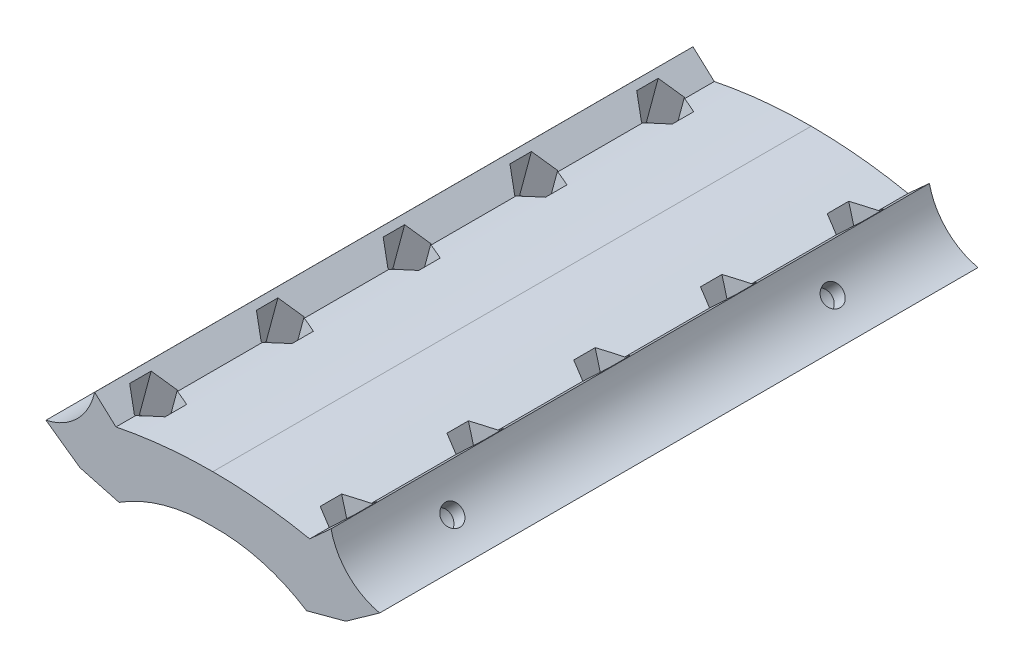
from build123d import *

# Parameters (mm, degrees)
BOSS_EXTRUDE1_DEPTH = 118
SKETCH2_R           = 2
CUT_EXTRUDE1_DEPTH  = 30
FILLET1_R           = 0.7
CUT_EXTRUDE2_DEPTH  = 30
SKETCH4_R           = 2.025006332
CUT_EXTRUDE4_DEPTH  = 30
SKETCH5_R           = 4
CUT_EXTRUDE5_DEPTH  = 30
FILLET2_R           = 0.7


# Read off the part's stored shape, not the designer's step: Boss-Extrude1
with BuildPart() as part:
    # Boss-Extrude1 outline → Boss-Extrude1 (new body)
    with BuildSketch(Plane.XY):
        with BuildLine():
            Line((128.714574933, 74.457877785), (135.398397795, 79.207299656))
            ThreePointArc((135.398397795, 79.207299656), (129.199240907, 82.59368811), (125.816397641, 88.794780298))
            Line((125.816397641, 88.794780298), (121.602102319, 84.969981006))
            ThreePointArc((121.602102319, 84.969981006), (112.099366948, 86.413667221), (102.499992147, 86.901737764))
            ThreePointArc((102.499992147, 86.901737764), (92.900246357, 86.421019341), (83.396408081, 84.984611511))
            Line((83.396408081, 84.984611511), (79.185043335, 88.812637329))
            ThreePointArc((79.185043335, 88.812637329), (75.797451765, 82.614137814), (69.595703125, 79.232498169))
            Line((69.595703125, 79.232498169), (76.275886536, 74.477958679))
            Line((76.275886536, 74.477958679), (83.999649048, 72.402679443))
            ThreePointArc((83.999649048, 72.402679443), (92.865835754, 76.342994102), (102.496399864, 77.520950486))
            ThreePointArc((102.496399864, 77.520950486), (112.126058975, 76.335618583), (120.989225269, 72.388514639))
            Line((120.989225269, 72.388514639), (128.714574933, 74.457877785))
        make_face()
    extrude(amount=BOSS_EXTRUDE1_DEPTH)

    # Sketch2 → Cut-Extrude1 (cut)
    with BuildSketch(Plane(origin=(23.799717723, 88.577654694, 0), x_dir=(0.9657473176210161, -0.2594843319119911, 0), z_dir=(-0.2594843319119911, -0.9657473176210161, 0))):
        with Locations((58.335991742, 110.012586744)):
            Circle(SKETCH2_R)
        with Locations((58.335991742, 85.012586744)):
            Circle(SKETCH2_R)
        with Locations((58.335991742, 60.012586744)):
            Circle(SKETCH2_R)
        with Locations((58.335991742, 35.012586744)):
            Circle(SKETCH2_R)
        with Locations((58.335991742, 10.012586744)):
            Circle(SKETCH2_R)
    cut_extrude1 = extrude(amount=-CUT_EXTRUDE1_DEPTH, mode=Mode.SUBTRACT)

    # Fillet1
    fillet1_edges = [part.edges().sort_by_distance(p)[0] for p in [
        (78.206050633, 73.959347515, 110.012586744),
        (78.206050633, 73.959347515, 85.012586744),
        (78.206050633, 73.959347515, 60.012586744),
        (78.206050633, 73.959347515, 35.012586744),
        (78.206050633, 73.959347515, 10.012586744),
    ]]
    fillet(fillet1_edges, radius=FILLET1_R)

    # Sketch3 → Cut-Extrude2 (cut)
    with BuildSketch(Plane(origin=(25.097139382, 93.406391282, 0), x_dir=(-0.9657473176210161, 0.2594843319119911, 0), z_dir=(-0.2594843319119911, -0.9657473176210161, 0))):
        Polygon((-58.327674116, -30.765472412), (-61.99488258, -32.882736206), (-61.99488258, -37.117263794), (-58.327674116, -39.234527588), (-54.660465652, -37.117263794), (-54.660465652, -32.882736206), align=None)
        Polygon((-58.327674116, -5.765472412), (-61.99488258, -7.882736206), (-61.99488258, -12.117263794), (-58.327674116, -14.234527588), (-54.660465652, -12.117263794), (-54.660465652, -7.882736206), align=None)
        Polygon((-58.327674116, -55.765472412), (-61.99488258, -57.882736206), (-61.99488258, -62.117263794), (-58.327674116, -64.234527588), (-54.660465652, -62.117263794), (-54.660465652, -57.882736206), align=None)
        Polygon((-58.327674116, -80.765472412), (-61.99488258, -82.882736206), (-61.99488258, -87.117263794), (-58.327674116, -89.234527588), (-54.660465652, -87.117263794), (-54.660465652, -82.882736206), align=None)
        Polygon((-58.327674116, -105.765472412), (-61.99488258, -107.882736206), (-61.99488258, -112.117263794), (-58.327674116, -114.234527588), (-54.660465652, -112.117263794), (-54.660465652, -107.882736206), align=None)
    cut_extrude2 = extrude(amount=-CUT_EXTRUDE2_DEPTH, mode=Mode.SUBTRACT)

    # Sketch4 → Cut-Extrude4 (cut)
    with BuildSketch(Plane(origin=(-4.851784108, 4.856443905, 0), x_dir=(-0.7074460998721094, -0.7067672995942453, 0), z_dir=(0.7067672995942453, -0.7074460998721094, 0))):
        with Locations((-112.014097146, -22.500039925)):
            Circle(SKETCH4_R)
        with Locations((-112.014097146, -97.500039925)):
            Circle(SKETCH4_R)
    cut_extrude4 = extrude(amount=CUT_EXTRUDE4_DEPTH, mode=Mode.SUBTRACT)

    # Sketch5 → Cut-Extrude5 (cut)
    with BuildSketch(Plane(origin=(-1.31794761, 1.319213406, 0), x_dir=(-0.7074460998721094, -0.7067672995942453, 0), z_dir=(0.7067672995942453, -0.7074460998721094, 0))):
        with Locations(Location((-112.014097146, -22.500039925, 0), (0, 0, 69.25209695))):
            Circle(SKETCH5_R)
        with Locations(Location((-112.014097146, -97.500039925, 0), (0, 0, 69.252096951))):
            Circle(SKETCH5_R)
    cut_extrude5 = extrude(amount=CUT_EXTRUDE5_DEPTH, mode=Mode.SUBTRACT)

    # Mirror2: Cut-Extrude1 across plane
    add(cut_extrude1.mirror(Plane(origin=(102.499992147, 86.901737764, 0), x_dir=(0, 0, 1), z_dir=(0.9999999266783173, -0.00038294041314253805, 0))), mode=Mode.SUBTRACT)

    # Mirror4: Cut-Extrude2, Cut-Extrude4, Cut-Extrude5 across plane
    add(cut_extrude2.mirror(Plane(origin=(102.499992147, 86.901737764, 0), x_dir=(0, 0, 1), z_dir=(0.9999999266783173, -0.00038294041314253805, 0))), mode=Mode.SUBTRACT)
    add(cut_extrude4.mirror(Plane(origin=(102.499992147, 86.901737764, 0), x_dir=(0, 0, 1), z_dir=(0.9999999266783173, -0.00038294041314253805, 0))), mode=Mode.SUBTRACT)
    add(cut_extrude5.mirror(Plane(origin=(102.499992147, 86.901737764, 0), x_dir=(0, 0, 1), z_dir=(0.9999999266783173, -0.00038294041314253805, 0))), mode=Mode.SUBTRACT)

    # Fillet2
    fillet2_edges = [part.edges().sort_by_distance(p)[0] for p in [
        (126.784014208, 73.940745048, 110.012586744),
        (126.784014208, 73.940745048, 85.012586744),
        (126.784014208, 73.940745048, 60.012586744),
        (126.784014208, 73.940745048, 35.012586744),
        (126.784014208, 73.940745048, 10.012586744),
    ]]
    fillet(fillet2_edges, radius=FILLET2_R)


solid = part.part
